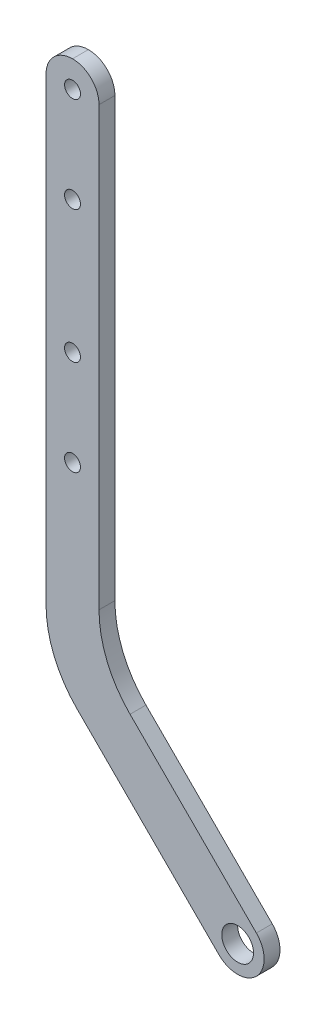
from build123d import *

# Parameters (mm, degrees)
SKETCH_1_R      = 1.5
SKETCH_1_R_2    = 3
EXTRUDE_1_DEPTH = 3
FILLET_1_R      = 20
FILLET_2_R      = 5
FILLET_3_R      = 5


with BuildPart() as part:
    # 草图1 → 凸台-拉伸1 (new body)
    with BuildSketch(Plane.XY):
        Polygon((0, 0), (0, 100), (10, 100), (10, 4.142135624), (43.235357393, -29.093221769), (36.164289581, -36.164289581), align=None)
        with Locations((5, 34)):
            Circle(SKETCH_1_R, mode=Mode.SUBTRACT)
        with Locations((36.164289581, -29.093221769)):
            Circle(SKETCH_1_R_2, mode=Mode.SUBTRACT)
        with Locations((5, 52)):
            Circle(SKETCH_1_R, mode=Mode.SUBTRACT)
        with Locations((5, 77)):
            Circle(SKETCH_1_R, mode=Mode.SUBTRACT)
        with Locations((5, 95)):
            Circle(SKETCH_1_R, mode=Mode.SUBTRACT)
    extrude(amount=EXTRUDE_1_DEPTH)

    # 圆角1
    fillet_1_edges = [part.edges().sort_by_distance(p)[0] for p in [
        (0, 0, 1.5),
        (10, 4.142135624, 1.5),
    ]]
    fillet(fillet_1_edges, radius=FILLET_1_R)

    # 圆角2
    fillet_2_edges = [part.edges().sort_by_distance(p)[0] for p in [
        (36.164289581, -36.164289581, 1.5),
        (43.235357393, -29.093221769, 1.5),
    ]]
    fillet(fillet_2_edges, radius=FILLET_2_R - 0.0001)  # a hair under: the kernel refuses the full size

    # 圆角3
    fillet_3_edges = [part.edges().sort_by_distance(p)[0] for p in [
        (0, 100, 1.5),
        (10, 100, 1.5),
    ]]
    fillet(fillet_3_edges, radius=FILLET_3_R - 0.0001)  # a hair under: the kernel refuses the full size


solid = part.part
